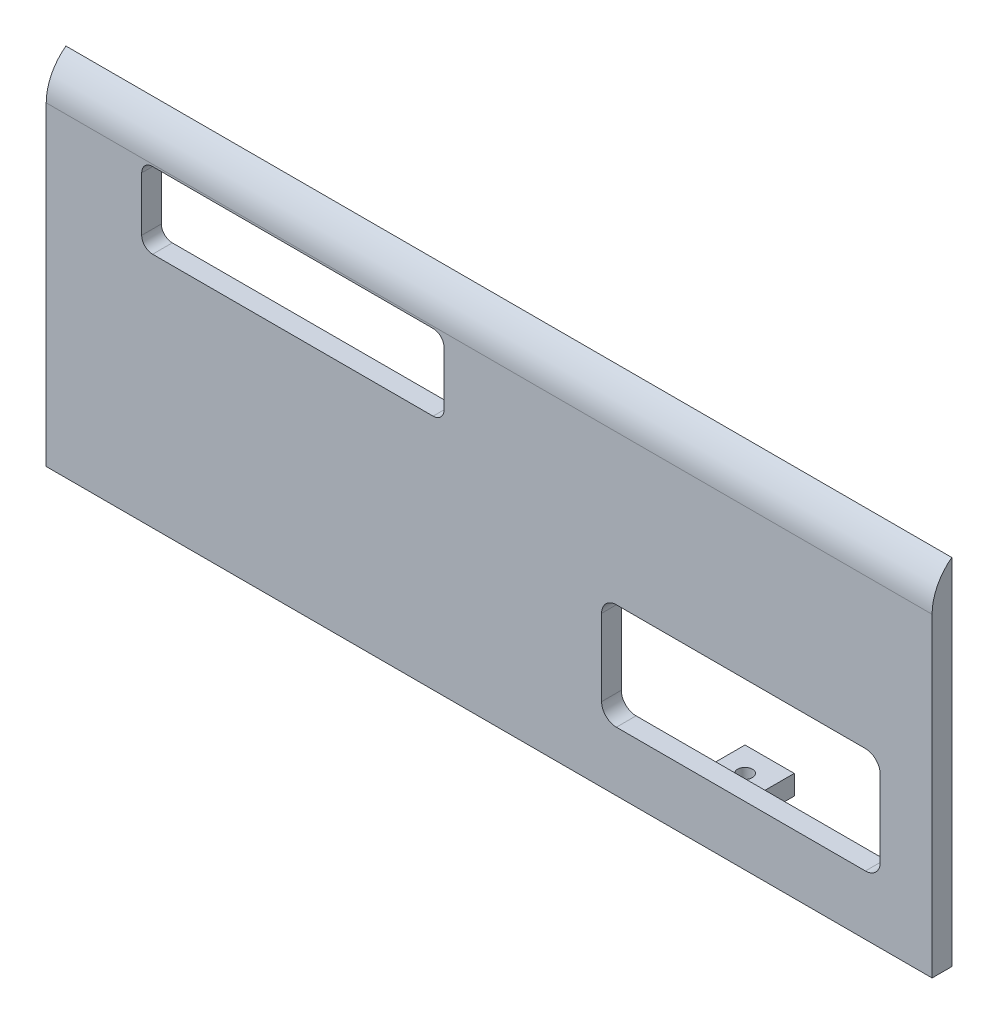
from build123d import *

# Parameters (mm, degrees)
SALIENTE_EXTRUIR1_DEPTH = 4
CROQUIS2_W              = 10
CROQUIS2_H              = 4
SALIENTE_EXTRUIR2_DEPTH = 10
CROQUIS3_R              = 1.5
CORTAR_EXTRUIR1_DEPTH   = 10
CROQUIS3_3_R            = 1.5
CORTAR_EXTRUIR2_DEPTH   = 1.65
REDONDEO2_R             = 10
CORTAR_EXTRUIR4_REACH   = 121.7
CROQUIS4_W              = 14.4
CROQUIS4_H              = 16.36262465
CROQUIS4_W_2            = 16.3
CROQUIS4_H_2            = 13.9
CROQUIS4_W_3            = 15.3
CROQUIS4_H_3            = 16.22
CROQUIS5_W              = 56.6
CROQUIS5_H              = 21.54262465
CORTAR_EXTRUIR5_DEPTH   = 4
REDONDEO3_R             = 3
CROQUIS6_W              = 61.43
CROQUIS6_H              = 15.43
CORTAR_EXTRUIR6_DEPTH   = 4
REDONDEO4_R             = 2.22
CROQUIS8_W              = 4
CROQUIS8_H              = 72
CORTAR_EXTRUIR7_DEPTH   = 4


with BuildPart() as part:
    # Croquis1 → Saliente-Extruir1 (new body)
    with BuildSketch(Plane.XY):
        with BuildLine():
            Line((-98, 60), (-98, -4))
            Line((-98, -4), (90, -4))
            Line((90, -4), (90, 60))
            ThreePointArc((90, 60), (88.94427191, 64.472135955), (86, 68))
            Line((86, 68), (-94, 68))
            ThreePointArc((-94, 68), (-96.94427191, 64.472135955), (-98, 60))
        make_face()
    extrude(amount=SALIENTE_EXTRUIR1_DEPTH)

    # Croquis2 → Saliente-Extruir2 (add)
    with BuildSketch(Plane(origin=(0, 0, 0), x_dir=(-1, 0, 0), z_dir=(0, 0, -1))):
        with Locations((46.991549296, 2)):
            Rectangle(CROQUIS2_W, CROQUIS2_H)
        with Locations((-38.991549296, 2)):
            Rectangle(CROQUIS2_W, CROQUIS2_H)
    extrude(amount=SALIENTE_EXTRUIR2_DEPTH)

    # Croquis3 → Cortar-Extruir1 (cut)
    with BuildSketch(Plane.XZ):
        with Locations((38.991549296, -5)):
            Circle(CROQUIS3_R)
        with Locations((-46.991549296, -5)):
            Circle(CROQUIS3_R)
    extrude(amount=-CORTAR_EXTRUIR1_DEPTH, mode=Mode.SUBTRACT)

    # Croquis3<3> → Cortar-Extruir2 (cut)
    # profile 1 of 2: a face of its own
    with BuildSketch(Plane.XZ):
        Polygon((-46.991549296, -8.175426481), (-44.241549296, -6.58771324), (-44.241549296, -3.41228676), (-46.991549296, -1.824573519), (-49.741549296, -3.41228676), (-49.741549296, -6.58771324), align=None)
        with Locations((-46.991549296, -5)):
            Circle(CROQUIS3_3_R, mode=Mode.SUBTRACT)
    # profile 2 of 2: a face of its own
    with BuildSketch(Plane.XZ):
        Polygon((38.991549296, -8.175426481), (41.741549296, -6.58771324), (41.741549296, -3.41228676), (38.991549296, -1.824573519), (36.241549296, -3.41228676), (36.241549296, -6.58771324), align=None)
        with Locations((38.991549296, -5)):
            Circle(CROQUIS3_3_R, mode=Mode.SUBTRACT)
    extrude(amount=-CORTAR_EXTRUIR2_DEPTH, mode=Mode.SUBTRACT)

    # Redondeo2
    # the kernel refuses this fillet: 10 mm, written as the material it takes off along each edge
    with BuildSketch(Plane(origin=(106, 68, 4), x_dir=(0, -1, 0), z_dir=(-1, 0, 0))) as redondeo2_piece_1:
        with BuildLine():
            CenterArc((8, -10), REDONDEO2_R, 90, 53.130102354)
            Line((0, -4), (-0.16, -3.88))
            ThreePointArc((-0.16, -3.88), (-0.2, -2), (-0.2, 0))
            Line((-0.2, 0), (0, 0.2))
            Line((0, 0.2), (8, 0.2))
            Line((8, 0.2), (8, 0))
        make_face()
    extrude(amount=220, mode=Mode.SUBTRACT)

    # Croquis4 → Cortar-Extruir4 (cut, up to next)
    with BuildSketch(Plane(origin=(0, 0, 0), x_dir=(-1, 0, 0), z_dir=(0, 0, -1)), mode=Mode.PRIVATE) as cortar_extruir4_sk1:
        with Locations((-46.4, 18.238687675)):
            Rectangle(CROQUIS4_W, CROQUIS4_H)
    cortar_extruir4_tool1 = extrude(cortar_extruir4_sk1.sketch, amount=-CORTAR_EXTRUIR4_REACH, mode=Mode.PRIVATE) & part.part
    # Croquis4 → Cortar-Extruir4 (cut, up to next)
    with BuildSketch(Plane(origin=(0, 0, 0), x_dir=(-1, 0, 0), z_dir=(0, 0, -1)), mode=Mode.PRIVATE) as cortar_extruir4_sk2:
        with Locations((-65.3, 20.65)):
            Rectangle(CROQUIS4_W_2, CROQUIS4_H_2)
    cortar_extruir4_tool2 = extrude(cortar_extruir4_sk2.sketch, amount=-CORTAR_EXTRUIR4_REACH, mode=Mode.PRIVATE) & part.part
    # Croquis4 → Cortar-Extruir4 (cut, up to next)
    with BuildSketch(Plane(origin=(0, 0, 0), x_dir=(-1, 0, 0), z_dir=(0, 0, -1)), mode=Mode.PRIVATE) as cortar_extruir4_sk3:
        with Locations((-28.5, 19.49)):
            Rectangle(CROQUIS4_W_3, CROQUIS4_H_3)
    cortar_extruir4_tool3 = extrude(cortar_extruir4_sk3.sketch, amount=-CORTAR_EXTRUIR4_REACH, mode=Mode.PRIVATE) & part.part
    add(cortar_extruir4_tool1.solids().sort_by_distance((46.4, 18.238688, 0))[0], mode=Mode.SUBTRACT)
    add(cortar_extruir4_tool2.solids().sort_by_distance((65.3, 20.65, 0))[0], mode=Mode.SUBTRACT)
    add(cortar_extruir4_tool3.solids().sort_by_distance((28.5, 19.49, 0))[0], mode=Mode.SUBTRACT)

    # Croquis5 → Cortar-Extruir5 (cut)
    with BuildSketch(Plane.XY.offset(4)):
        with Locations((47.15, 18.828687675)):
            Rectangle(CROQUIS5_W, CROQUIS5_H)
    extrude(amount=-CORTAR_EXTRUIR5_DEPTH, mode=Mode.SUBTRACT)

    # Redondeo3
    redondeo3_edges = [part.edges().sort_by_distance(p)[0] for p in [
        (75.45, 29.6, 2),
        (75.45, 8.05737535, 2),
        (18.85, 8.05737535, 2),
        (18.85, 29.6, 2),
    ]]
    fillet(redondeo3_edges, radius=REDONDEO3_R)

    # Croquis6 → Cortar-Extruir6 (cut)
    with BuildSketch(Plane.XY.offset(4)):
        with Locations((-43.885, 51.885)):
            Rectangle(CROQUIS6_W, CROQUIS6_H)
    extrude(amount=-CORTAR_EXTRUIR6_DEPTH, mode=Mode.SUBTRACT)

    # Redondeo4
    redondeo4_edges = [part.edges().sort_by_distance(p)[0] for p in [
        (-13.17, 59.6, 2),
        (-13.17, 44.17, 2),
        (-74.6, 44.17, 2),
        (-74.6, 59.6, 2),
    ]]
    fillet(redondeo4_edges, radius=REDONDEO4_R)

    # Croquis8 → Cortar-Extruir7 (cut)
    with BuildSketch(Plane.XY.offset(4)):
        with Locations((88, 32)):
            Rectangle(CROQUIS8_W, CROQUIS8_H)
        with Locations((-96, 32)):
            Rectangle(CROQUIS8_W, CROQUIS8_H)
    extrude(amount=-CORTAR_EXTRUIR7_DEPTH, mode=Mode.SUBTRACT)


solid = part.part
